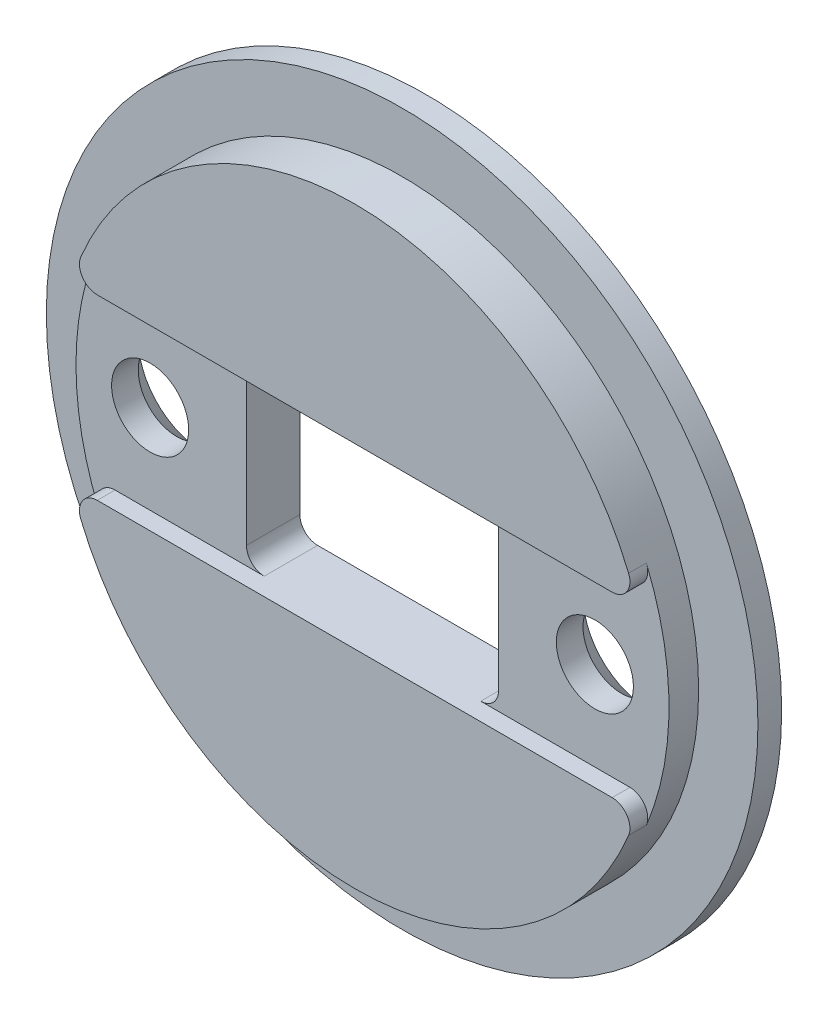
from build123d import *

# Parameters (mm, degrees)
SKIZZE14_W                                           = 8.5
SKIZZE14_H                                           = 6
SCHNITT_LINEAR_AUSTRAGEN4_DEPTH                      = 18.139428229
SKIZZE15_W                                           = 24
SKIZZE15_H                                           = 6
SCHNITT_LINEAR_AUSTRAGEN5_DEPTH                      = 0.6
VERRUNDUNG1_R                                        = 0.6
VERRUNDUNG2_R                                        = 0.6
FORMSENKUNG_F_R_M2_LINSENSENKSCHRAUBE_MI_D           = 2.6
FORMSENKUNG_F_R_M2_LINSENSENKSCHRAUBE_MI_CSINK_D     = 4.4
FORMSENKUNG_F_R_M2_LINSENSENKSCHRAUBE_MI_CSINK_ANGLE = 90


with BuildPart() as part:
    # Skizze2 → Rotation1 (revolve)
    with BuildSketch(Plane(origin=(0, 0, 0), x_dir=(1, 0, 0), z_dir=(0, 1, 0))):
        Polygon((0, 0), (10, 0), (10, 1.6), (12, 1.6), (12, 2.4), (0, 2.4), align=None)
    revolve(axis=Axis((0, 0, -2.4), (0, 0, 1)))

    # Skizze14 → Schnitt-Linear austragen4 (cut, through all)
    with BuildSketch(Plane.XY):
        Rectangle(SKIZZE14_W, SKIZZE14_H)
    extrude(amount=-SCHNITT_LINEAR_AUSTRAGEN4_DEPTH, mode=Mode.SUBTRACT)

    # Skizze15 → Schnitt-Linear austragen5 (cut)
    with BuildSketch(Plane.XY):
        Rectangle(SKIZZE15_W, SKIZZE15_H)
    extrude(amount=-SCHNITT_LINEAR_AUSTRAGEN5_DEPTH, mode=Mode.SUBTRACT)

    # Verrundung1
    verrundung1_edges = [part.edges().sort_by_distance(p)[0] for p in [
        (-4.25, -3, -1.5),
        (4.25, 3, -1.5),
        (4.25, -3, -1.5),
        (-4.25, 3, -1.5),
    ]]
    fillet(verrundung1_edges, radius=VERRUNDUNG1_R)

    # Verrundung2
    verrundung2_edges = [part.edges().sort_by_distance(p)[0] for p in [
        (-9.539392014, 3, -0.3),
        (9.539392014, -3, -0.3),
        (9.539392014, 3, -0.3),
        (-9.539392014, -3, -0.3),
    ]]
    fillet(verrundung2_edges, radius=VERRUNDUNG2_R)

    # Formsenkung für M2 Linsensenkschraube mit Schlitz1 (through all)
    with Locations(Plane(origin=(0, 0, -2.4), x_dir=(1, 0, 0), z_dir=(0, 0, -1))):
        with Locations((-7.5, 0), (7.5, 0)):
            CounterSinkHole(FORMSENKUNG_F_R_M2_LINSENSENKSCHRAUBE_MI_D / 2, FORMSENKUNG_F_R_M2_LINSENSENKSCHRAUBE_MI_CSINK_D / 2, counter_sink_angle=FORMSENKUNG_F_R_M2_LINSENSENKSCHRAUBE_MI_CSINK_ANGLE)


solid = part.part
